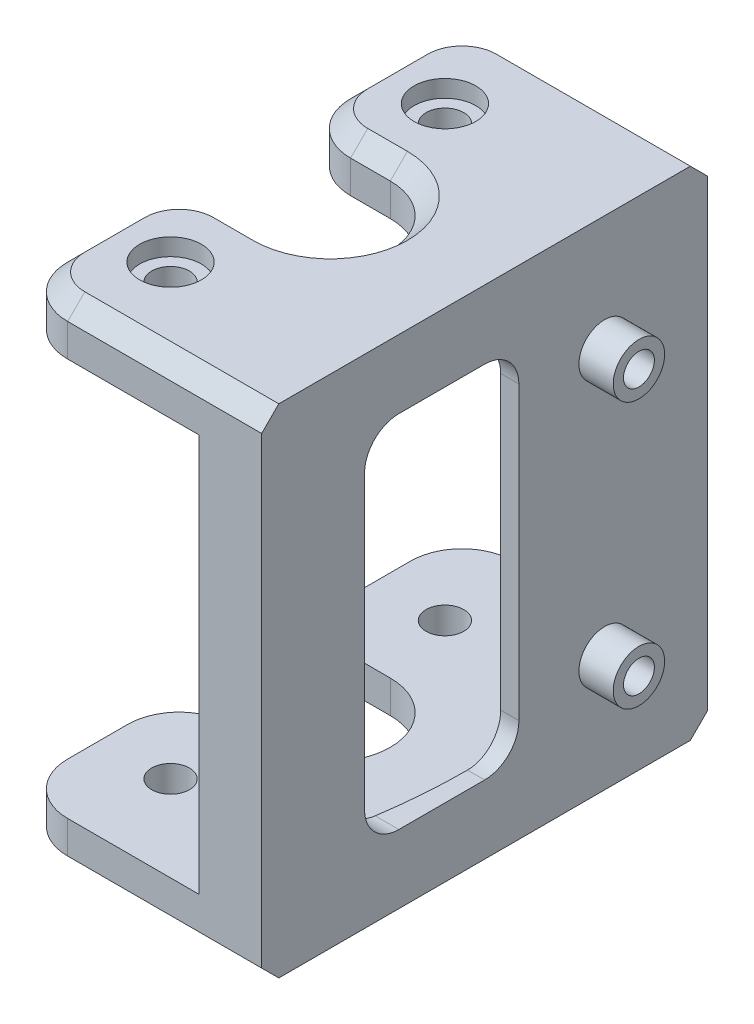
from build123d import *

# Parameters (mm, degrees)
SKETCH_1_R          = 1.1
EXTRUDE_1_DEPTH     = 14.5
SKETCH_2_R          = 33
CUT_EXTRUDE_1_DEPTH = 11.6
SKETCH_3_R          = 0.9
SKETCH_3_W          = 9
SKETCH_3_H          = 21
CUT_EXTRUDE_2_DEPTH = 25.169333236
EXTRUDE_START       = 2
SKETCH_4_R          = 1.5
SKETCH_4_R_2        = 0.9
EXTRUDE_2_DEPTH     = 2
FILLET_1_R          = 2
FILLET_2_R          = 3
CHAMFER_1_SIZE      = 1
SKETCH_5_R          = 1.8
CUT_EXTRUDE_3_DEPTH = 1


with BuildPart() as part:
    # Эскиз1 → Бобышка-Вытянуть1 (new, symmetric)
    with BuildSketch(Plane(origin=(0, 0, 0), x_dir=(1, 0, 0), z_dir=(0, 1, 0))):
        with BuildLine():
            Line((34, 13), (19.685438565, 13))
            Line((19.685438565, 13), (19.685438565, 3.5))
            Line((19.685438565, 3.5), (25, 3.5))
            ThreePointArc((25, 3.5), (27.474873734, 2.474873734), (28.5, 0))
            ThreePointArc((28.5, 0), (27.474873734, -2.474873734), (25, -3.5))
            Line((25, -3.5), (19.685438565, -3.5))
            Line((19.685438565, -3.5), (19.685438565, -13))
            Line((19.685438565, -13), (34, -13))
            Line((34, -13), (34, 13))
        make_face()
        with Locations((23.685438565, -8)):
            Circle(SKETCH_1_R, mode=Mode.SUBTRACT)
        with Locations((23.685438565, 8)):
            Circle(SKETCH_1_R, mode=Mode.SUBTRACT)
    extrude(amount=EXTRUDE_1_DEPTH, both=True)

    # Эскиз2 → Вырез-Вытянуть1 (cut, symmetric)
    with BuildSketch(Plane(origin=(0, 0, 0), x_dir=(1, 0, 0), z_dir=(0, 1, 0))):
        Circle(SKETCH_2_R)
    extrude(amount=CUT_EXTRUDE_1_DEPTH, both=True, mode=Mode.SUBTRACT)

    # Эскиз3 → Вырез-Вытянуть2 (cut, through all)
    with BuildSketch(Plane(origin=(34, 0, 0), x_dir=(0, 0, -1), z_dir=(1, 0, 0))):
        with Locations((7, 7.75)):
            Circle(SKETCH_3_R)
        with Locations((7, -7.75)):
            Circle(SKETCH_3_R)
        with Locations((-2.5, 0)):
            Rectangle(SKETCH_3_W, SKETCH_3_H)
    extrude(amount=-CUT_EXTRUDE_2_DEPTH, mode=Mode.SUBTRACT)

    # Эскиз4 → Бобышка-Вытянуть2 (add)
    # profile 1 of 2: a face of its own
    with BuildSketch(Plane(origin=(34, 0, 0), x_dir=(0, 0, -1), z_dir=(1, 0, 0)).offset(EXTRUDE_START)):
        with Locations((7, 7.75)):
            Circle(SKETCH_4_R)
        with Locations((7, 7.75)):
            Circle(SKETCH_4_R_2, mode=Mode.SUBTRACT)
    # profile 2 of 2: a face of its own
    with BuildSketch(Plane(origin=(34, 0, 0), x_dir=(0, 0, -1), z_dir=(1, 0, 0)).offset(EXTRUDE_START)):
        with Locations((7, -7.75)):
            Circle(SKETCH_4_R)
        with Locations((7, -7.75)):
            Circle(SKETCH_4_R_2, mode=Mode.SUBTRACT)
    extrude(amount=-EXTRUDE_2_DEPTH)

    # Скругление1
    fillet_1_edges = [part.edges().sort_by_distance(p)[0] for p in [
        (33.469669092, -10.5, -2),
        (33.469669092, 10.5, -2),
        (33.124515497, 10.5, 7),
        (33.124515497, -10.5, 7),
    ]]
    fillet(fillet_1_edges, radius=FILLET_1_R)

    # Скругление2
    fillet_2_edges = [part.edges().sort_by_distance(p)[0] for p in [
        (19.685438565, -13.05, -13),
        (19.685438565, -13.05, -3.5),
        (19.685438565, -13.05, 3.5),
        (19.685438565, -13.05, 13),
        (19.685438565, 13.05, -13),
        (19.685438565, 13.05, -3.5),
        (19.685438565, 13.05, 3.5),
        (19.685438565, 13.05, 13),
    ]]
    fillet(fillet_2_edges, radius=FILLET_2_R)

    # Фаска1
    chamfer_1_edges = [part.edges().sort_by_distance(p)[0] for p in [
        (28.342719282, -14.5, -13),
        (20.564118221, -14.5, -12.121320344),
        (19.685438565, -14.5, -8.25),
        (20.564118221, -14.5, -4.378679656),
        (23.842719282, -14.5, -3.5),
        (28.5, -14.5, 0),
        (23.842719282, -14.5, 3.5),
        (20.564118221, -14.5, 4.378679656),
        (19.685438565, -14.5, 8.25),
        (20.564118221, -14.5, 12.121320344),
        (28.342719282, -14.5, 13),
        (28.342719282, 14.5, -13),
        (20.564118221, 14.5, -12.121320344),
        (19.685438565, 14.5, -8.25),
        (20.564118221, 14.5, -4.378679656),
        (23.842719282, 14.5, -3.5),
        (28.5, 14.5, 0),
        (23.842719282, 14.5, 3.5),
        (20.564118221, 14.5, 4.378679656),
        (19.685438565, 14.5, 8.25),
        (20.564118221, 14.5, 12.121320344),
        (28.342719282, 14.5, 13),
    ]]
    chamfer(chamfer_1_edges, length=CHAMFER_1_SIZE)

    # Эскиз5 → Вырез-Вытянуть3 (cut)
    with BuildSketch(Plane(origin=(0, 14.5, 0), x_dir=(1, 0, 0), z_dir=(0, 1, 0))):
        with Locations((23.685438565, -8)):
            Circle(SKETCH_5_R)
        with Locations((23.685438565, 8)):
            Circle(SKETCH_5_R)
    cut_extrude_3 = extrude(amount=-CUT_EXTRUDE_3_DEPTH, mode=Mode.SUBTRACT)

    # Зеркальное отражение1: Вырез-Вытянуть3 across plane
    add(cut_extrude_3.mirror(Plane.ZX), mode=Mode.SUBTRACT)


solid = part.part
